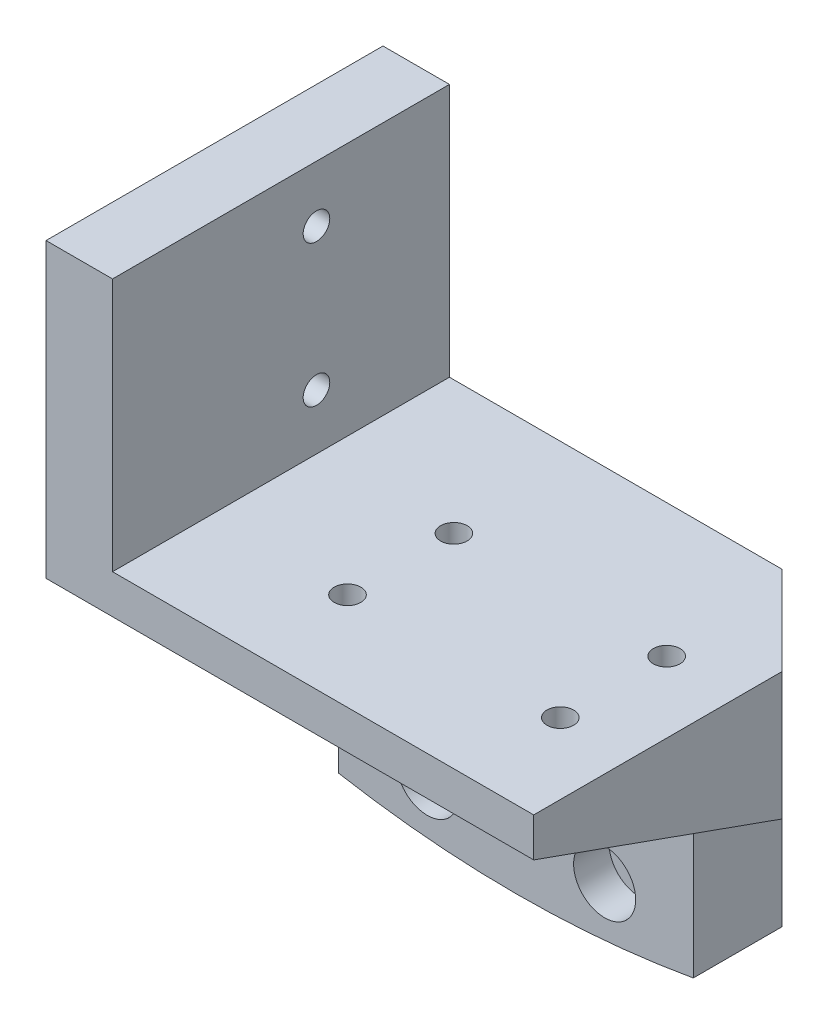
from build123d import *

# Parameters (mm, degrees)
BOSS_EXTRU_1_DEPTH      = 10
ENL_V_MAT_EXTRU_1_REACH = 118.172
ESQUISSE2_R             = 1.75
ESQUISSE4_R             = 3.5
ENL_V_MAT_EXTRU_2_DEPTH = 4
ESQUISSE5_W             = 50
ESQUISSE5_H             = 38
BOSS_EXTRU_2_DEPTH      = 14.4
ENL_V_MAT_EXTRU_3_REACH = 55.304
ESQUISSE6_R             = 1.5
ESQUISSE7_R             = 3
ENL_V_MAT_EXTRU_4_DEPTH = 9.4
CHANFREIN1_SIZE         = 10
CHANFREIN2_SIZE         = 28
CHANFREIN2_SIZE_2       = 10
BOSS_EXTRU_3_DEPTH      = 5
ESQUISSE9_W             = 38
ESQUISSE9_H             = 28.6
BOSS_EXTRU_4_DEPTH      = 2.5
CHANFREIN3_SIZE         = 5
ENL_V_MAT_EXTRU_5_REACH = 134.155
ESQUISSE10_R            = 1.5
ESQUISSE11_R            = 3
ENL_V_MAT_EXTRU_6_DEPTH = 2.5


# Some blends are built 0.0001 mm under size
with BuildPart() as part:
    # Esquisse1 → Boss.-Extru.1 (new body)
    with BuildSketch(Plane.XY):
        with BuildLine():
            Line((-20, -112.231902773), (-20, -91.7))
            Line((-20, -91.7), (20, -91.7))
            Line((20, -91.7), (20, -112.231902773))
            ThreePointArc((20, -112.231902773), (0, -114), (-20, -112.231902773))
        make_face()
    extrude(amount=BOSS_EXTRU_1_DEPTH)

    # Esquisse2 → Enlèv. mat.-Extru.1 (cut, up to next)
    with BuildSketch(Plane.XY.offset(10), mode=Mode.PRIVATE) as enl_v_mat_extru_1_sk1:
        with Locations((-10, -97.85)):
            Circle(ESQUISSE2_R)
    enl_v_mat_extru_1_tool1 = extrude(enl_v_mat_extru_1_sk1.sketch, amount=-ENL_V_MAT_EXTRU_1_REACH, mode=Mode.PRIVATE) & part.part
    # Esquisse2 → Enlèv. mat.-Extru.1 (cut, up to next)
    with BuildSketch(Plane.XY.offset(10), mode=Mode.PRIVATE) as enl_v_mat_extru_1_sk2:
        with Locations((-10, -107.85)):
            Circle(ESQUISSE2_R)
    enl_v_mat_extru_1_tool2 = extrude(enl_v_mat_extru_1_sk2.sketch, amount=-ENL_V_MAT_EXTRU_1_REACH, mode=Mode.PRIVATE) & part.part
    # Esquisse2 → Enlèv. mat.-Extru.1 (cut, up to next)
    with BuildSketch(Plane.XY.offset(10), mode=Mode.PRIVATE) as enl_v_mat_extru_1_sk3:
        with Locations((10, -97.85)):
            Circle(ESQUISSE2_R)
    enl_v_mat_extru_1_tool3 = extrude(enl_v_mat_extru_1_sk3.sketch, amount=-ENL_V_MAT_EXTRU_1_REACH, mode=Mode.PRIVATE) & part.part
    # Esquisse2 → Enlèv. mat.-Extru.1 (cut, up to next)
    with BuildSketch(Plane.XY.offset(10), mode=Mode.PRIVATE) as enl_v_mat_extru_1_sk4:
        with Locations((10, -107.85)):
            Circle(ESQUISSE2_R)
    enl_v_mat_extru_1_tool4 = extrude(enl_v_mat_extru_1_sk4.sketch, amount=-ENL_V_MAT_EXTRU_1_REACH, mode=Mode.PRIVATE) & part.part
    add(enl_v_mat_extru_1_tool1.solids().sort_by_distance((-10, -97.85, 10))[0], mode=Mode.SUBTRACT)
    add(enl_v_mat_extru_1_tool2.solids().sort_by_distance((-10, -107.85, 10))[0], mode=Mode.SUBTRACT)
    add(enl_v_mat_extru_1_tool3.solids().sort_by_distance((10, -97.85, 10))[0], mode=Mode.SUBTRACT)
    add(enl_v_mat_extru_1_tool4.solids().sort_by_distance((10, -107.85, 10))[0], mode=Mode.SUBTRACT)

    # Esquisse4 → Enlèv. mat.-Extru.2 (cut)
    with BuildSketch(Plane.XY.offset(10)):
        with Locations((-10, -97.85)):
            Circle(ESQUISSE4_R)
        with Locations((10, -97.85)):
            Circle(ESQUISSE4_R)
        with Locations((10, -107.85)):
            Circle(ESQUISSE4_R)
        with Locations((-10, -107.85)):
            Circle(ESQUISSE4_R)
    extrude(amount=-ENL_V_MAT_EXTRU_2_DEPTH, mode=Mode.SUBTRACT)

    # Esquisse5 → Boss.-Extru.2 (add)
    with BuildSketch(Plane(origin=(0, -91.7, 0), x_dir=(1, 0, 0), z_dir=(0, 1, 0))):
        with Locations((5, -19)):
            Rectangle(ESQUISSE5_W, ESQUISSE5_H)
    extrude(amount=BOSS_EXTRU_2_DEPTH)

    # Esquisse6 → Enlèv. mat.-Extru.3 (cut, up to next)
    with BuildSketch(Plane.XZ.offset(91.7), mode=Mode.PRIVATE) as enl_v_mat_extru_3_sk1:
        with Locations(Location((-2, 27, 0), (0, 0, 270))):
            Circle(ESQUISSE6_R)
    enl_v_mat_extru_3_tool1 = extrude(enl_v_mat_extru_3_sk1.sketch, amount=-ENL_V_MAT_EXTRU_3_REACH, mode=Mode.PRIVATE) & part.part
    # Esquisse6 → Enlèv. mat.-Extru.3 (cut, up to next)
    with BuildSketch(Plane.XZ.offset(91.7), mode=Mode.PRIVATE) as enl_v_mat_extru_3_sk2:
        with Locations(Location((22, 27, 0), (0, 0, 270))):
            Circle(ESQUISSE6_R)
    enl_v_mat_extru_3_tool2 = extrude(enl_v_mat_extru_3_sk2.sketch, amount=-ENL_V_MAT_EXTRU_3_REACH, mode=Mode.PRIVATE) & part.part
    # Esquisse6 → Enlèv. mat.-Extru.3 (cut, up to next)
    with BuildSketch(Plane.XZ.offset(91.7), mode=Mode.PRIVATE) as enl_v_mat_extru_3_sk3:
        with Locations(Location((-2, 15, 0), (0, 0, 270))):
            Circle(ESQUISSE6_R)
    enl_v_mat_extru_3_tool3 = extrude(enl_v_mat_extru_3_sk3.sketch, amount=-ENL_V_MAT_EXTRU_3_REACH, mode=Mode.PRIVATE) & part.part
    # Esquisse6 → Enlèv. mat.-Extru.3 (cut, up to next)
    with BuildSketch(Plane.XZ.offset(91.7), mode=Mode.PRIVATE) as enl_v_mat_extru_3_sk4:
        with Locations(Location((22, 15, 0), (0, 0, 270))):
            Circle(ESQUISSE6_R)
    enl_v_mat_extru_3_tool4 = extrude(enl_v_mat_extru_3_sk4.sketch, amount=-ENL_V_MAT_EXTRU_3_REACH, mode=Mode.PRIVATE) & part.part
    add(enl_v_mat_extru_3_tool1.solids().sort_by_distance((-2, -91.7, 27))[0], mode=Mode.SUBTRACT)
    add(enl_v_mat_extru_3_tool2.solids().sort_by_distance((22, -91.7, 27))[0], mode=Mode.SUBTRACT)
    add(enl_v_mat_extru_3_tool3.solids().sort_by_distance((-2, -91.7, 15))[0], mode=Mode.SUBTRACT)
    add(enl_v_mat_extru_3_tool4.solids().sort_by_distance((22, -91.7, 15))[0], mode=Mode.SUBTRACT)

    # Esquisse7 → Enlèv. mat.-Extru.4 (cut)
    with BuildSketch(Plane.XZ.offset(91.7)):
        with Locations(Location((-2, 27, 0), (0, 0, 270))):
            Circle(ESQUISSE7_R)
        with Locations(Location((22, 27, 0), (0, 0, 270))):
            Circle(ESQUISSE7_R)
        with Locations(Location((22, 15, 0), (0, 0, 270))):
            Circle(ESQUISSE7_R)
        with Locations(Location((-2, 15, 0), (0, 0, 270))):
            Circle(ESQUISSE7_R)
    extrude(amount=-ENL_V_MAT_EXTRU_4_DEPTH, mode=Mode.SUBTRACT)

    # Chanfrein1
    chanfrein1_edges = [part.edges().sort_by_distance(p)[0] for p in [
        (30, -84.5, 0),
    ]]
    chamfer(chanfrein1_edges, length=CHANFREIN1_SIZE)

    # Chanfrein2
    # the kernel refuses this chamfer: 28, 10 mm, written as the material it takes off along each edge
    with BuildSketch(Plane(origin=(102.642981969, -91.7, 38), x_dir=(0, -0.01296397650632004, -0.9999159641255577), z_dir=(-1, 0, 0))) as chanfrein2_piece_1:
        Polygon((CHANFREIN2_SIZE * 0.999915964126, -CHANFREIN2_SIZE * 0.0129639765063), (-CHANFREIN2_SIZE_2 * 0.0129639765063, -CHANFREIN2_SIZE_2 * 0.999915964126), (0, 0), align=None)
    extrude(amount=195.285963938, mode=Mode.SUBTRACT)

    # Esquisse8 → Boss.-Extru.3 (add)
    with BuildSketch(Plane.ZY.offset(20)):
        Polygon((10, -91.7), (0, -91.7), (0, -48.7), (38, -48.7), (38, -81.7), align=None)
    extrude(amount=BOSS_EXTRU_3_DEPTH)

    # Esquisse9 → Boss.-Extru.4 (add)
    with BuildSketch(Plane(origin=(-20, 0, 0), x_dir=(0, 0, -1), z_dir=(1, 0, 0))):
        with Locations((-19, -63)):
            Rectangle(ESQUISSE9_W, ESQUISSE9_H)
    extrude(amount=BOSS_EXTRU_4_DEPTH)

    # Chanfrein3
    chanfrein3_edges = [part.edges().sort_by_distance(p)[0] for p in [
        (-20, -91.7, 5),
    ]]
    chamfer(chanfrein3_edges, length=CHANFREIN3_SIZE - 0.0001)  # a hair under: the kernel refuses the full size

    # Esquisse10 → Enlèv. mat.-Extru.5 (cut, up to next)
    with BuildSketch(Plane.ZY.offset(25), mode=Mode.PRIVATE) as enl_v_mat_extru_5_sk1:
        with Locations(Location((15, -55.05, 0), (0, 0, 270))):
            Circle(ESQUISSE10_R)
    enl_v_mat_extru_5_tool1 = extrude(enl_v_mat_extru_5_sk1.sketch, amount=-ENL_V_MAT_EXTRU_5_REACH, mode=Mode.PRIVATE) & part.part
    # Esquisse10 → Enlèv. mat.-Extru.5 (cut, up to next)
    with BuildSketch(Plane.ZY.offset(25), mode=Mode.PRIVATE) as enl_v_mat_extru_5_sk2:
        with Locations(Location((15, -71.05, 0), (0, 0, 270))):
            Circle(ESQUISSE10_R)
    enl_v_mat_extru_5_tool2 = extrude(enl_v_mat_extru_5_sk2.sketch, amount=-ENL_V_MAT_EXTRU_5_REACH, mode=Mode.PRIVATE) & part.part
    add(enl_v_mat_extru_5_tool1.solids().sort_by_distance((-25, -55.05, 15))[0], mode=Mode.SUBTRACT)
    add(enl_v_mat_extru_5_tool2.solids().sort_by_distance((-25, -71.05, 15))[0], mode=Mode.SUBTRACT)

    # Esquisse11 → Enlèv. mat.-Extru.6 (cut)
    with BuildSketch(Plane.ZY.offset(25)):
        with Locations(Location((15, -55.05, 0), (0, 0, 270))):
            Circle(ESQUISSE11_R)
        with Locations(Location((15, -71.05, 0), (0, 0, 270))):
            Circle(ESQUISSE11_R)
    extrude(amount=-ENL_V_MAT_EXTRU_6_DEPTH, mode=Mode.SUBTRACT)


solid = part.part
